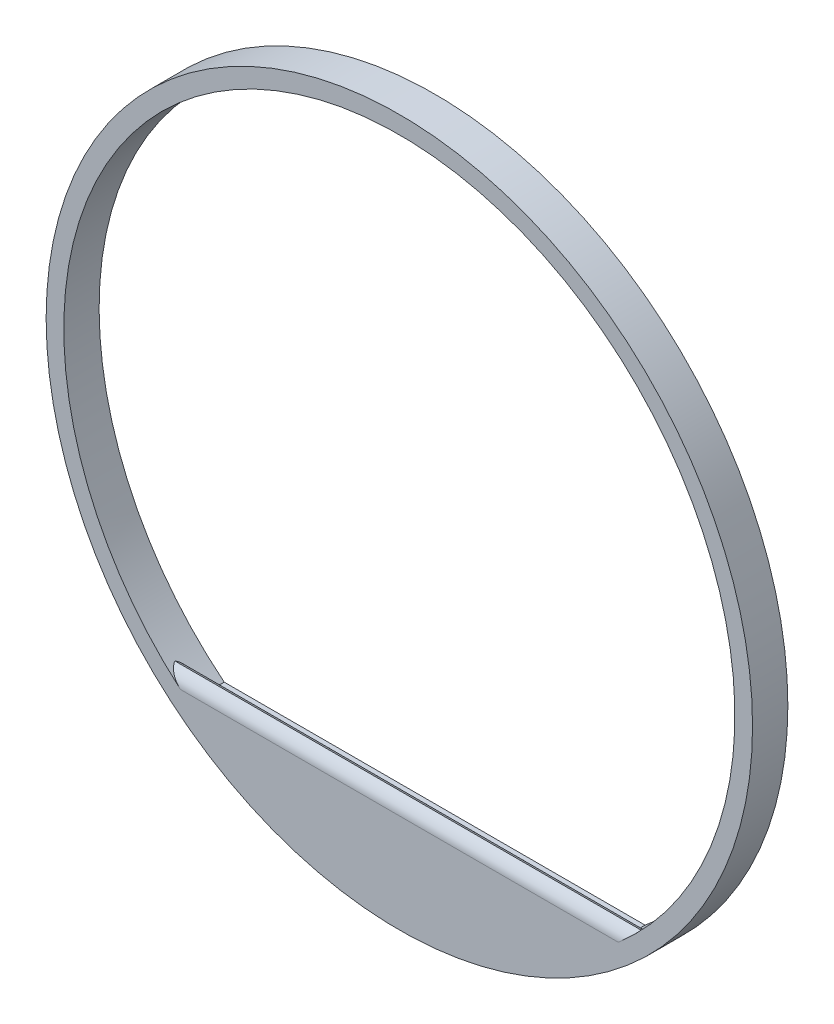
from build123d import *

# Parameters (mm, degrees)
ESQUISSE1_R        = 50
ESQUISSE1_R_2      = 47.5
BOSS_EXTRU_1_DEPTH = 5
BOSS_EXTRU_2_START = -2.5
BOSS_EXTRU_2_DEPTH = 2.5
CONG_2_R           = 2
BOSS_EXTRU_3_START = 2.5
BOSS_EXTRU_3_DEPTH = 2.5


with BuildPart() as part:
    # Esquisse1 → Boss.-Extru.1 (new body)
    with BuildSketch(Plane.XY):
        Circle(ESQUISSE1_R)
        Circle(ESQUISSE1_R_2, mode=Mode.SUBTRACT)
    extrude(amount=BOSS_EXTRU_1_DEPTH)

    # Esquisse2 → Boss.-Extru.2 (add)
    with BuildSketch(Plane.XY.offset(5).offset(BOSS_EXTRU_2_START)):
        with BuildLine():
            Line((-33.170016581, -34), (33.170016581, -34))
            ThreePointArc((33.170016581, -34), (0, -47.5), (-33.170016581, -34))
        make_face()
    extrude(amount=BOSS_EXTRU_2_DEPTH)

    # Congé2
    # the kernel refuses this fillet: 2 mm, written as the material it takes off along each edge
    with BuildSketch(Plane(origin=(-38.170016581, -34, 5), x_dir=(0, -1, 0), z_dir=(1, 0, 0))) as cong_2_piece_1_section:
        with BuildLine():
            CenterArc((CONG_2_R, CONG_2_R), CONG_2_R, 180, 90)
            Line((0, CONG_2_R), (0, 0))
            Line((0, 0), (CONG_2_R, 0))
        make_face()
    cong_2_piece_1 = extrude(amount=76.340033162, mode=Mode.PRIVATE)
    cong_2_piece_1 = cong_2_piece_1 & Plane(origin=(0, 0, 4.543639328), x_dir=(1, 0, 0), z_dir=(0, 0, -1)) * Cylinder(47.5, 161, mode=Mode.PRIVATE)
    add(cong_2_piece_1, mode=Mode.SUBTRACT)
    with BuildSketch(Plane(origin=(-38.170016581, -34, 2.5), x_dir=(0, 0, 1), z_dir=(1, 0, 0))) as cong_2_piece_2_section:
        with BuildLine():
            CenterArc((CONG_2_R, CONG_2_R), CONG_2_R, 180, 90)
            Line((0, CONG_2_R), (0, 0))
            Line((0, 0), (CONG_2_R, 0))
        make_face()
    cong_2_piece_2 = extrude(amount=76.340033162, mode=Mode.PRIVATE)
    cong_2_piece_2 = cong_2_piece_2 & Plane(origin=(0, 0, 2.956360666), x_dir=(1, 0, 0), z_dir=(0, 0, -1)) * Cylinder(47.5, 161, mode=Mode.PRIVATE)
    add(cong_2_piece_2, mode=Mode.SUBTRACT)

    # Esquisse3 → Boss.-Extru.3 (add)
    with BuildSketch(Plane(origin=(0, 0, 2.5), x_dir=(-1, 0, 0), z_dir=(0, 0, -1)).offset(BOSS_EXTRU_3_START)):
        with BuildLine():
            Line((-29.786742017, -37), (29.786742017, -37))
            ThreePointArc((29.786742017, -37), (0, -47.5), (-29.786742017, -37))
        make_face()
    extrude(amount=-BOSS_EXTRU_3_DEPTH)


solid = part.part
